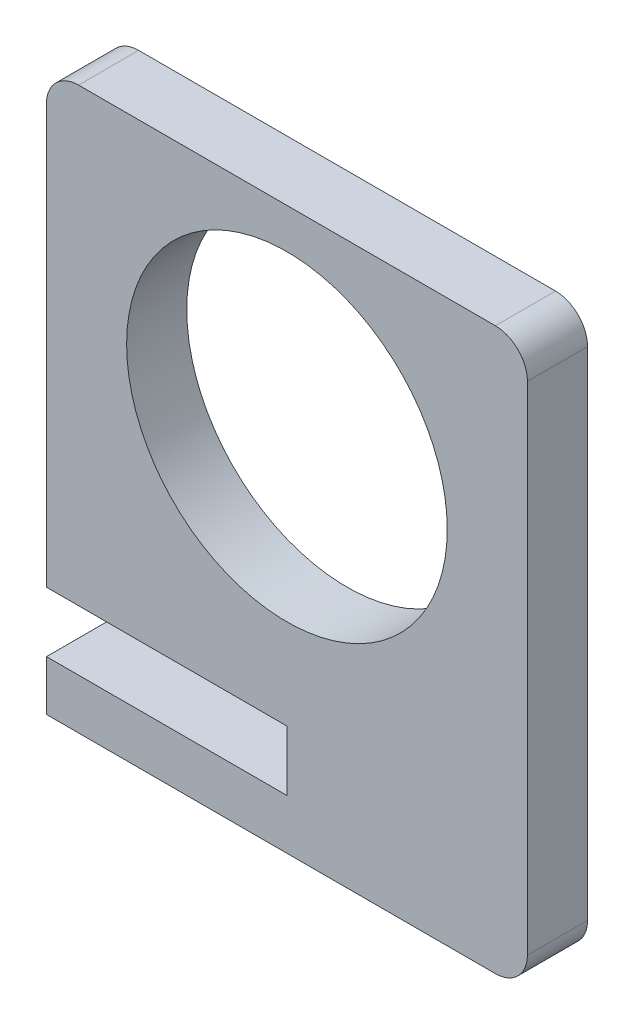
from build123d import *

# Parameters (mm, degrees)
SKETCH1_R           = 12.7
BOSS_EXTRUDE1_DEPTH = 2.38125
FILLET1_R           = 2.54


with BuildPart() as part:
    # Sketch1 → Boss-Extrude1 (new, symmetric)
    with BuildSketch(Plane.XY):
        Polygon((-19.05, 2.38125), (0, 2.38125), (0, -2.38125), (-19.05, -2.38125), (-19.05, -6.35), (19.05, -6.35), (19.05, 38.1), (-19.05, 38.1), align=None)
        with Locations((0, 22.225)):
            Circle(SKETCH1_R, mode=Mode.SUBTRACT)
    extrude(amount=BOSS_EXTRUDE1_DEPTH, both=True)

    # Fillet1
    fillet1_edges = [part.edges().sort_by_distance(p)[0] for p in [
        (19.05, -6.35, 0),
        (-19.05, 38.1, 0),
        (19.05, 38.1, 0),
    ]]
    fillet(fillet1_edges, radius=FILLET1_R)


solid = part.part
